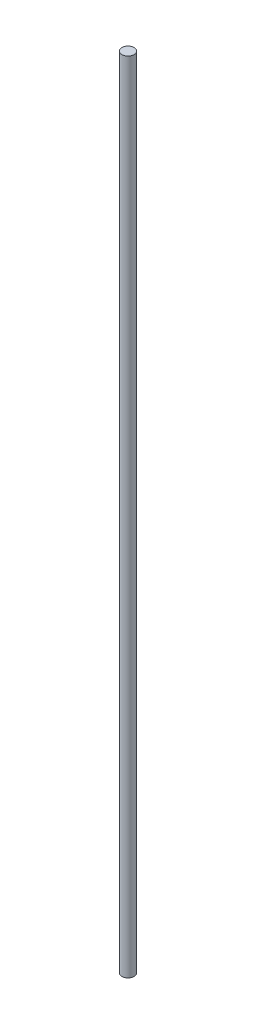
from build123d import *

# Parameters (mm, degrees)
SZKIC1_R                    = 4
DODANIE_WYCI_GNI_CIE1_DEPTH = 520


with BuildPart() as part:
    # Szkic1 → Dodanie-wyciągnięcie1 (new body)
    with BuildSketch(Plane(origin=(0, 0, 0), x_dir=(1, 0, 0), z_dir=(0, 1, 0))):
        Circle(SZKIC1_R)
    extrude(amount=DODANIE_WYCI_GNI_CIE1_DEPTH)


solid = part.part
